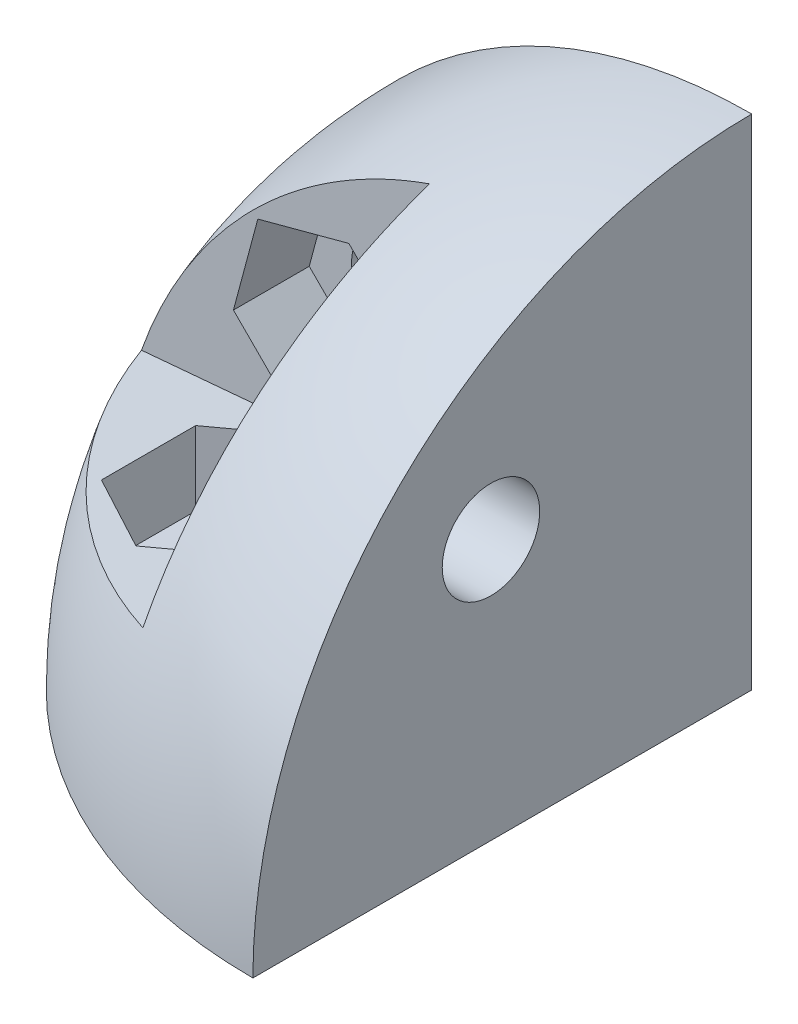
from build123d import *

# Parameters (mm, degrees)
REVOLVE1_ANGLE     = 90
SKETCH2_R          = 2.15
EXTRUDE1_DEPTH     = 39.105117767
EXTRUDE2_START     = 4
EXTRUDE2_DEPTH     = 35.105117767
EXTRUDE4_START     = -4
EXTRUDE4_DEPTH     = 35.105117767
CUT_REVOLVE1_START = 7.343078062
CUT_REVOLVE1_DEPTH = 11.608966683
EXTRUDE5_DEPTH     = 36.944401511


# Read off the part's stored shape, not the designer's step: Cut-Revolve1
with BuildPart() as part:
    # Sketch1 → Revolve1 (revolve)
    with BuildSketch(Plane(origin=(0, 0, 0), x_dir=(0, 0, -1), z_dir=(1, 0, 0))):
        with BuildLine():
            Line((0, 0), (0, 22))
            ThreePointArc((0, 22), (-15.556349186, 15.556349186), (-22, 0))
            Line((-22, 0), (0, 0))
        make_face()
    revolve(axis=Axis((0, 0, 0), (0, -1, 0)), revolution_arc=REVOLVE1_ANGLE)

    # Sketch2 → Extrude1 (cut, through all)
    with BuildSketch(Plane(origin=(0, 0, 0), x_dir=(1, 0, 0), z_dir=(0, 1, 0))):
        with Locations(Location((-11.5, -11.5, 0), (0, 0, 225))):
            Circle(SKETCH2_R)
    extrude1 = extrude(amount=EXTRUDE1_DEPTH, mode=Mode.SUBTRACT)

    # Sketch4 → Extrude2 (cut, through all)
    with BuildSketch(Plane(origin=(0, 0, 0), x_dir=(1, 0, 0), z_dir=(0, 1, 0)).offset(EXTRUDE2_START)):
        Polygon((-7.9, -9.421539031), (-11.5, -7.343078062), (-15.1, -9.421539031), (-15.1, -13.578460969), (-11.5, -15.656921938), (-7.9, -13.578460969), align=None)
    extrude2 = extrude(amount=EXTRUDE2_DEPTH, mode=Mode.SUBTRACT)

    # Mirror1: Extrude1 across plane
    add(extrude1.mirror(Plane(origin=(0, 0, 0), x_dir=(2.468850131082266e-15, 0.7071067811865478, 0.7071067811865472), z_dir=(2.4688501310822653e-15, 0.7071067811865475, -0.7071067811865477))), mode=Mode.SUBTRACT)

    # Mirror5: Extrude1, Extrude2 across plane
    add(extrude1.mirror(Plane(origin=(0, 0, 0), x_dir=(0, 0, 1), z_dir=(-0.7071067811865475, -0.7071067811865477, 0))), mode=Mode.SUBTRACT)
    add(extrude2.mirror(Plane(origin=(0, 0, 0), x_dir=(0, 0, 1), z_dir=(-0.7071067811865475, -0.7071067811865477, 0))), mode=Mode.SUBTRACT)

    # Sketch9 → Extrude4 (cut, through all)
    with BuildSketch(Plane(origin=(0, 0, 0), x_dir=(-1, 0, 0), z_dir=(0, 0, -1)).offset(EXTRUDE4_START)):
        Polygon((8.560612309, 8.560612309), (12.575890567, 7.484721742), (15.515278258, 10.424109433), (14.439387691, 14.439387691), (10.424109433, 15.515278258), (7.484721742, 12.575890567), align=None)
    extrude(amount=-EXTRUDE4_DEPTH, mode=Mode.SUBTRACT)

    # Cut-Revolve1 outline → Cut-Revolve1 (cut)
    with BuildSketch(Plane.XY.offset(CUT_REVOLVE1_START)):
        Polygon((-11.5, 7.58027444), (-7.9, 7.9), (-7.484721742, 12.575890567), (-8.560612309, 8.560612309), (-12.575890567, 7.484721742), align=None)
        Polygon((-7.484721742, 12.575890567), (-6.863589335, 19.569628152), (-6.736554213, 21), (-21, 21), (-21, 6.736554212), (-19.569628152, 6.863589334), (-12.575890567, 7.484721742), (-15.515278258, 10.424109433), (-14.439387691, 14.439387691), (-10.424109433, 15.515278258), align=None)
    extrude(amount=CUT_REVOLVE1_DEPTH, mode=Mode.SUBTRACT)

    # Sketch11 → Revolve4 (revolve)
    with BuildSketch(Plane(origin=(-0.757954206, 8.534304053, 0), x_dir=(0.9960793346659582, 0.08846445077782496, 0), z_dir=(-0.08846445077782496, 0.9960793346659582, 0))):
        Polygon((-7.170157583, -9.421539031), (-7.170157583, -7.343078062), (-10.784327534, -7.343078062), align=None)
    revolve(axis=Axis((-7.9, 7.9, 9.421539031), (0, 0, -1)))

    # Sketch12 → Extrude5 (cut, through all)
    with BuildSketch(Plane.XY.offset(4)):
        Polygon((-8.560612309, 8.560612309), (-7.484721742, 12.575890567), (-10.424109433, 15.515278258), (-14.439387691, 14.439387691), (-15.515278258, 10.424109433), (-12.575890567, 7.484721742), align=None)
    extrude(amount=EXTRUDE5_DEPTH, mode=Mode.SUBTRACT)


solid = part.part
